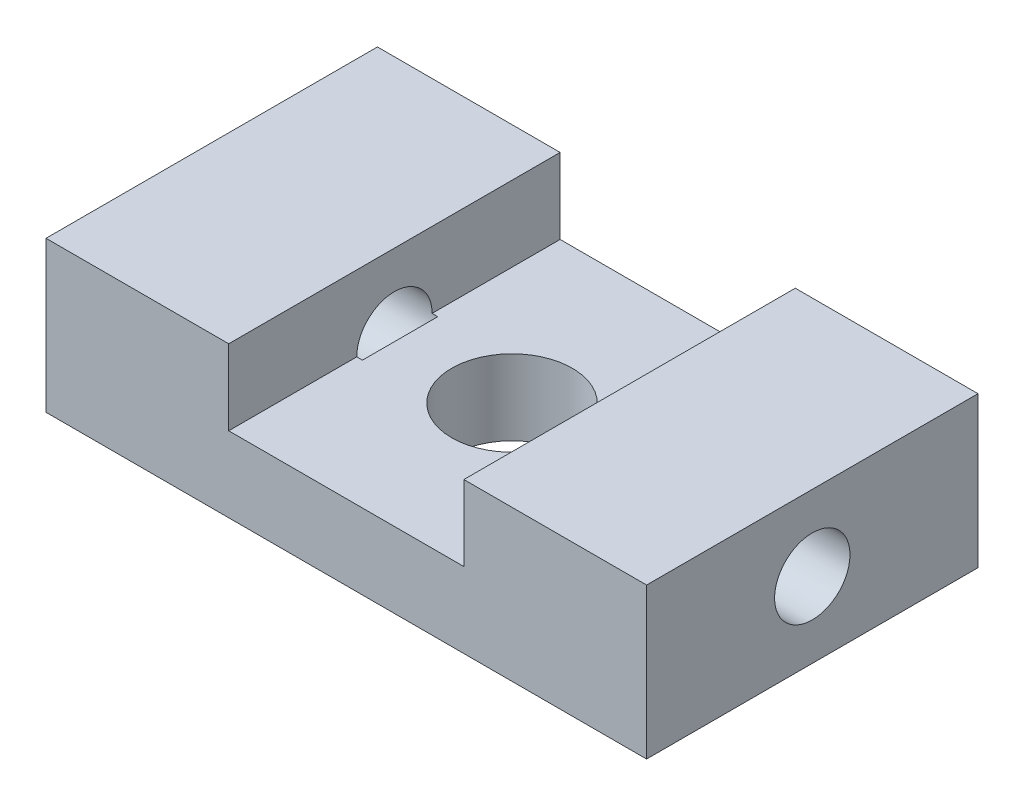
from build123d import *

# Parameters (mm, degrees)
SKETCH_1_W          = 79.688684702
SKETCH_1_H          = 43.973938876
SKETCH_1_R          = 8
EXTRUDE_1_DEPTH     = 20
SKETCH_2_R          = 5
CUT_EXTRUDE_2_DEPTH = 25
CUT_EXTRUDE_START   = -25
SKETCH_3_R          = 5
CUT_EXTRUDE_3_DEPTH = 25
SKETCH_4_W          = 31.2
SKETCH_4_H          = 50
CUT_EXTRUDE_4_DEPTH = 10


with BuildPart() as part:
    # Эскиз1 → Вытянуть1 (new body)
    with BuildSketch(Plane(origin=(0, 0, 0), x_dir=(1, 0, 0), z_dir=(0, 1, 0))):
        Rectangle(SKETCH_1_W, SKETCH_1_H)
        Circle(SKETCH_1_R, mode=Mode.SUBTRACT)
    extrude(amount=EXTRUDE_1_DEPTH)

    # Эскиз2 → Вытянуть2 (cut)
    with BuildSketch(Plane.ZY.offset(39.844342351)):
        with Locations((0, 10)):
            Circle(SKETCH_2_R)
    extrude(amount=-CUT_EXTRUDE_2_DEPTH, mode=Mode.SUBTRACT)

    # Эскиз3 → Вытянуть3 (cut)
    with BuildSketch(Plane(origin=(39.844342351, 0, 0), x_dir=(0, 0, -1), z_dir=(1, 0, 0)).offset(CUT_EXTRUDE_START)):
        with Locations((0, 10)):
            Circle(SKETCH_3_R)
    extrude(amount=CUT_EXTRUDE_3_DEPTH, mode=Mode.SUBTRACT)

    # Эскиз4 → Вытянуть4 (cut)
    with BuildSketch(Plane(origin=(0, 20, 0), x_dir=(1, 0, 0), z_dir=(0, 1, 0))):
        Rectangle(SKETCH_4_W, SKETCH_4_H)
    extrude(amount=-CUT_EXTRUDE_4_DEPTH, mode=Mode.SUBTRACT)


solid = part.part
